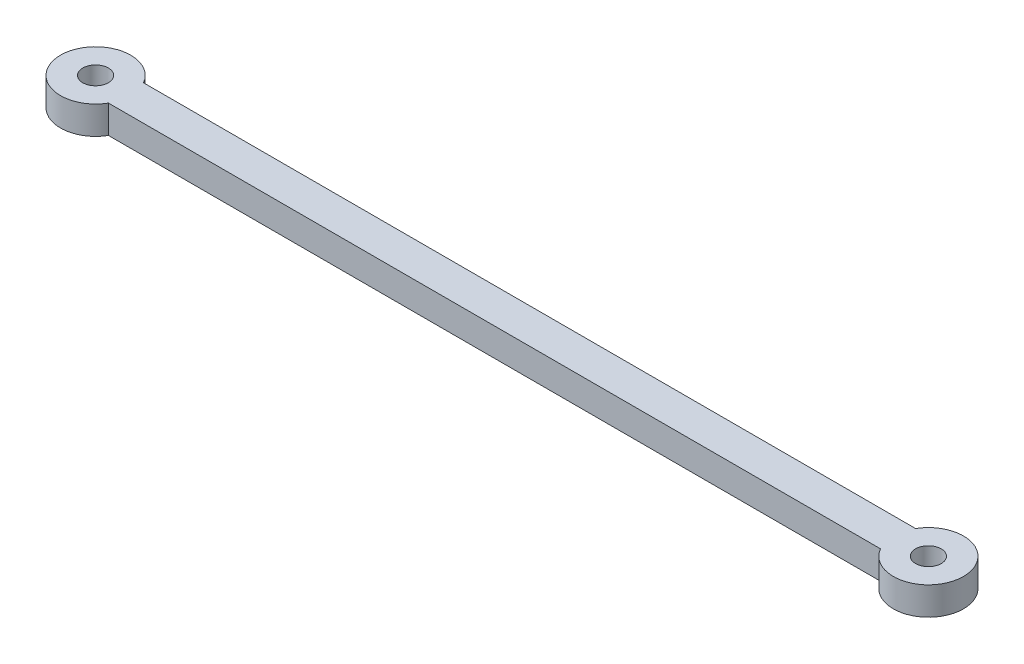
from build123d import *

# Parameters (mm, degrees)
BOSS_EXTRUDE1_DEPTH = 4
SKETCH2_R           = 1.825
CUT_EXTRUDE1_DEPTH  = 65.64801035


with BuildPart() as part:
    # Sketch1 → Boss-Extrude1 (new body)
    with BuildSketch(Plane(origin=(0, 0, 0), x_dir=(1, 0, 0), z_dir=(0, 1, 0))):
        with BuildLine():
            Line((-55, 2.5), (55, 2.5))
            ThreePointArc((55, 2.5), (64.330127019, 0), (55, -2.5))
            Line((55, -2.5), (-55, -2.5))
            ThreePointArc((-55, -2.5), (-64.330127019, 0), (-55, 2.5))
        make_face()
    extrude(amount=BOSS_EXTRUDE1_DEPTH)

    # Sketch2 → Cut-Extrude1 (cut, through all)
    with BuildSketch(Plane(origin=(0, 4, 0), x_dir=(1, 0, 0), z_dir=(0, 1, 0))):
        with Locations((-59.330127019, 0)):
            Circle(SKETCH2_R)
        with Locations((59.330127019, 0)):
            Circle(SKETCH2_R)
    extrude(amount=-CUT_EXTRUDE1_DEPTH, mode=Mode.SUBTRACT)


solid = part.part
